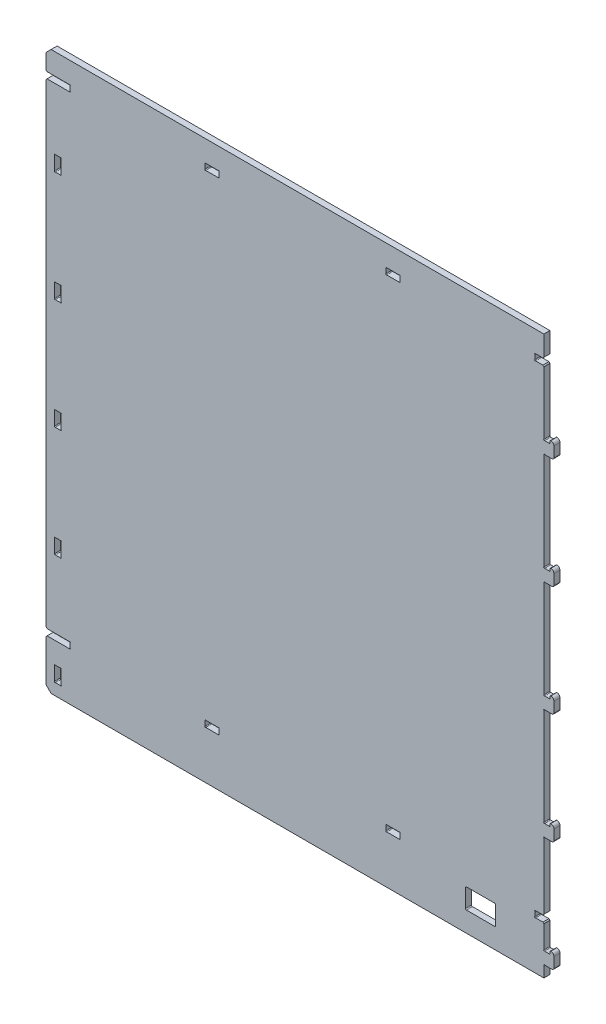
from build123d import *

# Parameters (mm, degrees)
STOCK_BOX_SIDE_1_DEPTH = 6
CUT_EXTRUDE3_DEPTH     = 751.659816428


# Read off the part's stored shape, not the designer's step: Stock-box_side-1
with BuildPart() as part:
    # Stock-box_side-1 outline → Stock-box_side-1 (new body)
    with BuildSketch(Plane.XY):
        with BuildLine():
            Line((495.4, 534.9), (495.4, 555))
            Line((495.4, 555), (5, 555))
            Line((5, 555), (0, 550))
            Line((0, 550), (0, 534.9))
            Line((0, 534.9), (1, 533.9))
            Line((1, 533.9), (23.292893219, 533.9))
            ThreePointArc((23.292893219, 533.9), (24, 533.9), (24, 533.192893219))
            Line((24, 533.192893219), (24, 528.407106781))
            ThreePointArc((24, 528.407106781), (24, 527.7), (23.292893219, 527.7))
            Line((23.292893219, 527.7), (1, 527.7))
            Line((1, 527.7), (0, 526.7))
            Line((0, 526.7), (0, 54.9))
            Line((0, 54.9), (1, 53.9))
            Line((1, 53.9), (23.292893219, 53.9))
            ThreePointArc((23.292893219, 53.9), (24, 53.9), (24, 53.192893219))
            Line((24, 53.192893219), (24, 48.407106781))
            ThreePointArc((24, 48.407106781), (24, 47.7), (23.292893219, 47.7))
            Line((23.292893219, 47.7), (1, 47.7))
            Line((1, 47.7), (0, 46.7))
            Line((0, 46.7), (0, 5))
            Line((0, 5), (5, 0))
            Line((5, 0), (495.4, 0))
            Line((495.4, 0), (495.4, 10.792893219))
            ThreePointArc((495.4, 10.792893219), (495.4, 11.5), (496.107106781, 11.5))
            Line((496.107106781, 11.5), (503.4, 11.5))
            ThreePointArc((503.4, 11.5), (504.814213562, 12.085786438), (505.4, 13.5))
            Line((505.4, 13.5), (505.4, 23.500062699))
            ThreePointArc((505.4, 23.500062699), (504.521320344, 25.621383043), (502.4, 26.500062699))
            ThreePointArc((502.4, 26.500062699), (501.692893218, 26.20716948), (501.4, 25.500062699))
            Line((501.4, 25.500062699), (501.4, 24.207169481))
            ThreePointArc((501.4, 24.207169481), (501.4, 23.5000627), (500.692893219, 23.500062699))
            Line((500.692893219, 23.500062699), (496.107106781, 23.500062699))
            ThreePointArc((496.107106781, 23.500062699), (495.399999999, 23.500062699), (495.4, 24.207169481))
            Line((495.4, 24.207169481), (495.4, 46.7))
            Line((495.4, 46.7), (494.4, 47.7))
            Line((494.4, 47.7), (487.107106781, 47.7))
            ThreePointArc((487.107106781, 47.7), (486.4, 47.7), (486.4, 48.407106781))
            Line((486.4, 48.407106781), (486.4, 53.192893219))
            ThreePointArc((486.4, 53.192893219), (486.4, 53.9), (487.107106781, 53.9))
            Line((487.107106781, 53.9), (494.4, 53.9))
            Line((494.4, 53.9), (495.4, 54.9))
            Line((495.4, 54.9), (495.4, 120.792893219))
            ThreePointArc((495.4, 120.792893219), (495.4, 121.5), (496.107106781, 121.5))
            Line((496.107106781, 121.5), (503.4, 121.5))
            ThreePointArc((503.4, 121.5), (504.814213562, 122.085786438), (505.4, 123.5))
            Line((505.4, 123.5), (505.4, 133.500062699))
            ThreePointArc((505.4, 133.500062699), (504.521320344, 135.621383043), (502.4, 136.500062699))
            ThreePointArc((502.4, 136.500062699), (501.692893218, 136.20716948), (501.4, 135.500062699))
            Line((501.4, 135.500062699), (501.4, 134.207169481))
            ThreePointArc((501.4, 134.207169481), (501.4, 133.5000627), (500.692893219, 133.500062699))
            Line((500.692893219, 133.500062699), (496.107106781, 133.500062699))
            ThreePointArc((496.107106781, 133.500062699), (495.399999999, 133.500062699), (495.4, 134.207169481))
            Line((495.4, 134.207169481), (495.4, 230.792893219))
            ThreePointArc((495.4, 230.792893219), (495.4, 231.5), (496.107106781, 231.5))
            Line((496.107106781, 231.5), (503.4, 231.5))
            ThreePointArc((503.4, 231.5), (504.814213562, 232.085786438), (505.4, 233.5))
            Line((505.4, 233.5), (505.4, 243.500062699))
            ThreePointArc((505.4, 243.500062699), (504.521320344, 245.621383043), (502.4, 246.500062699))
            ThreePointArc((502.4, 246.500062699), (501.692893218, 246.20716948), (501.4, 245.500062699))
            Line((501.4, 245.500062699), (501.4, 244.207169481))
            ThreePointArc((501.4, 244.207169481), (501.4, 243.5000627), (500.692893219, 243.500062699))
            Line((500.692893219, 243.500062699), (496.107106781, 243.500062699))
            ThreePointArc((496.107106781, 243.500062699), (495.399999999, 243.500062699), (495.4, 244.207169481))
            Line((495.4, 244.207169481), (495.4, 340.792893219))
            ThreePointArc((495.4, 340.792893219), (495.4, 341.5), (496.107106781, 341.5))
            Line((496.107106781, 341.5), (503.4, 341.5))
            ThreePointArc((503.4, 341.5), (504.814213562, 342.085786438), (505.4, 343.5))
            Line((505.4, 343.5), (505.4, 353.500062699))
            ThreePointArc((505.4, 353.500062699), (504.521320344, 355.621383043), (502.4, 356.500062699))
            ThreePointArc((502.4, 356.500062699), (501.692893218, 356.20716948), (501.4, 355.500062699))
            Line((501.4, 355.500062699), (501.4, 354.207169481))
            ThreePointArc((501.4, 354.207169481), (501.4, 353.5000627), (500.692893219, 353.500062699))
            Line((500.692893219, 353.500062699), (496.107106781, 353.500062699))
            ThreePointArc((496.107106781, 353.500062699), (495.399999999, 353.5000627), (495.4, 354.207169481))
            Line((495.4, 354.207169481), (495.4, 450.792893219))
            ThreePointArc((495.4, 450.792893219), (495.4, 451.5), (496.107106781, 451.5))
            Line((496.107106781, 451.5), (503.4, 451.5))
            ThreePointArc((503.4, 451.5), (504.814213562, 452.085786438), (505.4, 453.5))
            Line((505.4, 453.5), (505.4, 463.500062699))
            ThreePointArc((505.4, 463.500062699), (504.521320344, 465.621383043), (502.4, 466.500062699))
            ThreePointArc((502.4, 466.500062699), (501.692893218, 466.20716948), (501.4, 465.500062699))
            Line((501.4, 465.500062699), (501.4, 464.207169481))
            ThreePointArc((501.4, 464.207169481), (501.4, 463.5000627), (500.692893219, 463.500062699))
            Line((500.692893219, 463.500062699), (496.107106781, 463.500062699))
            ThreePointArc((496.107106781, 463.500062699), (495.399999999, 463.5000627), (495.4, 464.207169481))
            Line((495.4, 464.207169481), (495.4, 526.7))
            Line((495.4, 526.7), (494.4, 527.7))
            Line((494.4, 527.7), (487.107106781, 527.7))
            ThreePointArc((487.107106781, 527.7), (486.4, 527.7), (486.4, 528.407106781))
            Line((486.4, 528.407106781), (486.4, 533.192893219))
            ThreePointArc((486.4, 533.192893219), (486.4, 533.9), (487.107106781, 533.9))
            Line((487.107106781, 533.9), (494.4, 533.9))
            Line((494.4, 533.9), (495.4, 534.9))
        make_face()
        with BuildLine():
            Line((9.207106781, 26.5), (14.292893219, 26.5))
            ThreePointArc((14.292893219, 26.5), (15, 26.5), (15, 25.792893219))
            Line((15, 25.792893219), (15, 12.207106781))
            ThreePointArc((15, 12.207106781), (15, 11.5), (14.292893219, 11.5))
            Line((14.292893219, 11.5), (9.207106781, 11.5))
            ThreePointArc((9.207106781, 11.5), (8.5, 11.5), (8.5, 12.207106781))
            Line((8.5, 12.207106781), (8.5, 25.792893219))
            ThreePointArc((8.5, 25.792893219), (8.5, 26.5), (9.207106781, 26.5))
        make_face(mode=Mode.SUBTRACT)
        with BuildLine():
            Line((9.207106781, 136.5), (14.292893219, 136.5))
            ThreePointArc((14.292893219, 136.5), (15, 136.5), (15, 135.792893219))
            Line((15, 135.792893219), (15, 122.207106781))
            ThreePointArc((15, 122.207106781), (15, 121.5), (14.292893219, 121.5))
            Line((14.292893219, 121.5), (9.207106781, 121.5))
            ThreePointArc((9.207106781, 121.5), (8.5, 121.5), (8.5, 122.207106781))
            Line((8.5, 122.207106781), (8.5, 135.792893219))
            ThreePointArc((8.5, 135.792893219), (8.5, 136.5), (9.207106781, 136.5))
        make_face(mode=Mode.SUBTRACT)
        with BuildLine():
            Line((158.2, 48.407106781), (158.2, 53.192893219))
            ThreePointArc((158.2, 53.192893219), (158.2, 53.9), (158.907106781, 53.9))
            Line((158.907106781, 53.9), (171.492893219, 53.9))
            ThreePointArc((171.492893219, 53.9), (172.2, 53.9), (172.2, 53.192893219))
            Line((172.2, 53.192893219), (172.2, 48.407106781))
            ThreePointArc((172.2, 48.407106781), (172.2, 47.7), (171.492893219, 47.7))
            Line((171.492893219, 47.7), (158.907106781, 47.7))
            ThreePointArc((158.907106781, 47.7), (158.2, 47.7), (158.2, 48.407106781))
        make_face(mode=Mode.SUBTRACT)
        with BuildLine():
            Line((9.207106781, 246.5), (14.292893219, 246.5))
            ThreePointArc((14.292893219, 246.5), (15, 246.5), (15, 245.792893219))
            Line((15, 245.792893219), (15, 232.207106781))
            ThreePointArc((15, 232.207106781), (15, 231.5), (14.292893219, 231.5))
            Line((14.292893219, 231.5), (9.207106781, 231.5))
            ThreePointArc((9.207106781, 231.5), (8.5, 231.5), (8.5, 232.207106781))
            Line((8.5, 232.207106781), (8.5, 245.792893219))
            ThreePointArc((8.5, 245.792893219), (8.5, 246.5), (9.207106781, 246.5))
        make_face(mode=Mode.SUBTRACT)
        with BuildLine():
            Line((338.2, 48.407106781), (338.2, 53.192893219))
            ThreePointArc((338.2, 53.192893219), (338.2, 53.9), (338.907106781, 53.9))
            Line((338.907106781, 53.9), (351.492893219, 53.9))
            ThreePointArc((351.492893219, 53.9), (352.2, 53.9), (352.2, 53.192893219))
            Line((352.2, 53.192893219), (352.2, 48.407106781))
            ThreePointArc((352.2, 48.407106781), (352.2, 47.7), (351.492893219, 47.7))
            Line((351.492893219, 47.7), (338.907106781, 47.7))
            ThreePointArc((338.907106781, 47.7), (338.2, 47.7), (338.2, 48.407106781))
        make_face(mode=Mode.SUBTRACT)
        with BuildLine():
            Line((9.207106781, 356.5), (14.292893219, 356.5))
            ThreePointArc((14.292893219, 356.5), (15, 356.5), (15, 355.792893219))
            Line((15, 355.792893219), (15, 342.207106781))
            ThreePointArc((15, 342.207106781), (15, 341.5), (14.292893219, 341.5))
            Line((14.292893219, 341.5), (9.207106781, 341.5))
            ThreePointArc((9.207106781, 341.5), (8.5, 341.5), (8.5, 342.207106781))
            Line((8.5, 342.207106781), (8.5, 355.792893219))
            ThreePointArc((8.5, 355.792893219), (8.5, 356.5), (9.207106781, 356.5))
        make_face(mode=Mode.SUBTRACT)
        with BuildLine():
            Line((9.207106781, 466.5), (14.292893219, 466.5))
            ThreePointArc((14.292893219, 466.5), (15, 466.5), (15, 465.792893219))
            Line((15, 465.792893219), (15, 452.207106781))
            ThreePointArc((15, 452.207106781), (15, 451.5), (14.292893219, 451.5))
            Line((14.292893219, 451.5), (9.207106781, 451.5))
            ThreePointArc((9.207106781, 451.5), (8.5, 451.5), (8.5, 452.207106781))
            Line((8.5, 452.207106781), (8.5, 465.792893219))
            ThreePointArc((8.5, 465.792893219), (8.5, 466.5), (9.207106781, 466.5))
        make_face(mode=Mode.SUBTRACT)
        with BuildLine():
            Line((158.2, 528.407106781), (158.2, 533.192893219))
            ThreePointArc((158.2, 533.192893219), (158.2, 533.9), (158.907106781, 533.9))
            Line((158.907106781, 533.9), (171.492893219, 533.9))
            ThreePointArc((171.492893219, 533.9), (172.2, 533.9), (172.2, 533.192893219))
            Line((172.2, 533.192893219), (172.2, 528.407106781))
            ThreePointArc((172.2, 528.407106781), (172.2, 527.7), (171.492893219, 527.7))
            Line((171.492893219, 527.7), (158.907106781, 527.7))
            ThreePointArc((158.907106781, 527.7), (158.2, 527.7), (158.2, 528.407106781))
        make_face(mode=Mode.SUBTRACT)
        with BuildLine():
            Line((338.2, 528.407106781), (338.2, 533.192893219))
            ThreePointArc((338.2, 533.192893219), (338.2, 533.9), (338.907106781, 533.9))
            Line((338.907106781, 533.9), (351.492893219, 533.9))
            ThreePointArc((351.492893219, 533.9), (352.2, 533.9), (352.2, 533.192893219))
            Line((352.2, 533.192893219), (352.2, 528.407106781))
            ThreePointArc((352.2, 528.407106781), (352.2, 527.7), (351.492893219, 527.7))
            Line((351.492893219, 527.7), (338.907106781, 527.7))
            ThreePointArc((338.907106781, 527.7), (338.2, 527.7), (338.2, 528.407106781))
        make_face(mode=Mode.SUBTRACT)
    extrude(amount=STOCK_BOX_SIDE_1_DEPTH)

    # Sketch3 → Cut-Extrude3 (cut, through all)
    with BuildSketch(Plane(origin=(0, 0, 0), x_dir=(-1, 0, 0), z_dir=(0, 0, -1))):
        with BuildLine():
            Line((-446.4, 40), (-418.4, 40))
            ThreePointArc((-418.4, 40), (-417.692893219, 39.707106781), (-417.4, 39))
            Line((-417.4, 39), (-417.4, 21))
            ThreePointArc((-417.4, 21), (-417.692893219, 20.292893219), (-418.4, 20))
            Line((-418.4, 20), (-446.4, 20))
            ThreePointArc((-446.4, 20), (-447.107106781, 20.292893219), (-447.4, 21))
            Line((-447.4, 21), (-447.4, 39))
            ThreePointArc((-447.4, 39), (-447.107106781, 39.707106781), (-446.4, 40))
        make_face()
    extrude(amount=-CUT_EXTRUDE3_DEPTH, mode=Mode.SUBTRACT)


solid = part.part
